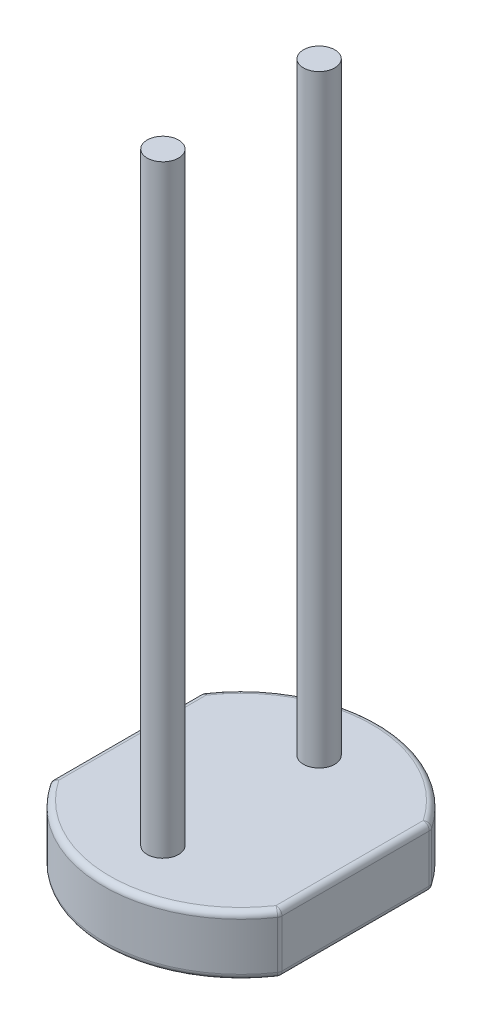
from build123d import *

# Parameters (mm, degrees)
BOSS_EXTRUDE1_DEPTH      = 1
BOSS_EXTRUDE2_DEPTH      = 10
BOSS_EXTRUDE2_DEPTH_BACK = 1.1
SKETCH2_R                = 0.26
CUT_EXTRUDE1_DEPTH       = 0.01
FILLET1_R                = 0.1


with BuildPart() as part:
    # Sketch1 → Boss-Extrude1 (new body)
    with BuildSketch(Plane(origin=(0, 0, 0), x_dir=(1, 0, 0), z_dir=(0, 1, 0))):
        with BuildLine():
            Line((-1.9, 1.251249376), (-1.9, -1.251249376))
            ThreePointArc((-1.9, -1.251249376), (0, -2.275), (1.9, -1.251249376))
            Line((1.9, -1.251249376), (1.9, 1.251249376))
            ThreePointArc((1.9, 1.251249376), (0, 2.275), (-1.9, 1.251249376))
        make_face()
    extrude(amount=BOSS_EXTRUDE1_DEPTH)

    # Sketch2 → Boss-Extrude2 (add, two sides: drawn at the far end of the back side and taken through both)
    with BuildSketch(Plane(origin=(0, 1, 0), x_dir=(1, 0, 0), z_dir=(0, 1, 0)).offset(-BOSS_EXTRUDE2_DEPTH_BACK)):
        with Locations((0, 1.295)):
            Circle(SKETCH2_R)
        with Locations((0, -1.295)):
            Circle(SKETCH2_R)
    extrude(amount=BOSS_EXTRUDE2_DEPTH + BOSS_EXTRUDE2_DEPTH_BACK)

    # Sketch4 → Cut-Extrude1 (cut)
    with BuildSketch(Plane.XZ):
        with BuildLine():
            Line((1.9, -1.251249376), (1.9, 1.251249376))
            ThreePointArc((1.9, 1.251249376), (0, 2.275), (-1.9, 1.251249376))
            Line((-1.9, 1.251249376), (-1.9, -1.251249376))
            ThreePointArc((-1.9, -1.251249376), (0, -2.275), (1.9, -1.251249376))
        make_face()
        with BuildLine():
            Line((-1.4, 1.091157642), (-1.4, -1.091157642))
            ThreePointArc((-1.4, -1.091157642), (0, -1.775), (1.4, -1.091157642))
            Line((1.4, -1.091157642), (1.4, 1.091157642))
            ThreePointArc((1.4, 1.091157642), (1.375341403, 1.122078885), (1.35, 1.152443057))
            Line((1.35, 1.152443057), (1.35, -1))
            ThreePointArc((1.35, -1), (1.2, -1.15), (1.05, -1))
            Line((1.05, -1), (1.05, 0.9))
            ThreePointArc((1.05, 0.9), (0.9, 1.05), (0.75, 0.9))
            Line((0.75, 0.9), (0.75, -0.9))
            ThreePointArc((0.75, -0.9), (0.6, -1.05), (0.45, -0.9))
            Line((0.45, -0.9), (0.45, 0.7))
            ThreePointArc((0.45, 0.7), (0.3, 0.85), (0.15, 0.7))
            Line((0.15, 0.7), (0.15, -0.75))
            ThreePointArc((0.15, -0.75), (0, -0.9), (-0.15, -0.75))
            Line((-0.15, -0.75), (-0.15, 0.7))
            ThreePointArc((-0.15, 0.7), (-0.3, 0.85), (-0.45, 0.7))
            Line((-0.45, 0.7), (-0.45, -0.9))
            ThreePointArc((-0.45, -0.9), (-0.6, -1.05), (-0.75, -0.9))
            Line((-0.75, -0.9), (-0.75, 0.9))
            ThreePointArc((-0.75, 0.9), (-0.9, 1.05), (-1.05, 0.9))
            Line((-1.05, 0.9), (-1.05, -1))
            ThreePointArc((-1.05, -1), (-1.2, -1.15), (-1.35, -1))
            Line((-1.35, -1), (-1.35, 1.152443057))
            ThreePointArc((-1.35, 1.152443057), (-1.375341403, 1.122078885), (-1.4, 1.091157642))
        make_face(mode=Mode.SUBTRACT)
        with BuildLine():
            Line((1.25, 1.152443057), (1.25, -1))
            ThreePointArc((1.25, -1), (1.2, -1.05), (1.15, -1))
            Line((1.15, -1), (1.15, 0.9))
            ThreePointArc((1.15, 0.9), (0.9, 1.15), (0.65, 0.9))
            Line((0.65, 0.9), (0.65, -0.9))
            ThreePointArc((0.65, -0.9), (0.6, -0.95), (0.55, -0.9))
            Line((0.55, -0.9), (0.55, 0.7))
            ThreePointArc((0.55, 0.7), (0.3, 0.95), (0.05, 0.7))
            Line((0.05, 0.7), (0.05, -0.75))
            ThreePointArc((0.05, -0.75), (0.035355339, -0.785355339), (0, -0.8))
            ThreePointArc((0, -0.8), (-0.035355339, -0.785355339), (-0.05, -0.75))
            Line((-0.05, -0.75), (-0.05, 0.7))
            ThreePointArc((-0.05, 0.7), (-0.3, 0.95), (-0.55, 0.7))
            Line((-0.55, 0.7), (-0.55, -0.9))
            ThreePointArc((-0.55, -0.9), (-0.6, -0.95), (-0.65, -0.9))
            Line((-0.65, -0.9), (-0.65, 0.9))
            ThreePointArc((-0.65, 0.9), (-0.9, 1.15), (-1.15, 0.9))
            Line((-1.15, 0.9), (-1.15, -1))
            ThreePointArc((-1.15, -1), (-1.2, -1.05), (-1.25, -1))
            Line((-1.25, -1), (-1.25, 1.152443057))
            Line((-1.25, 1.152443057), (-1.25, 1.260208316))
            ThreePointArc((-1.25, 1.260208316), (0, 1.775), (1.25, 1.260208316))
            Line((1.25, 1.260208316), (1.25, 1.152443057))
        make_face(mode=Mode.SUBTRACT)
    extrude(amount=-CUT_EXTRUDE1_DEPTH, mode=Mode.SUBTRACT)

    # Fillet1
    fillet1_edges = [part.edges().sort_by_distance(p)[0] for p in [
        (0, 1, 2.275),
        (-1.9, 1, 0),
        (-1.9, 0.505, 1.251249376),
        (-1.9, 0.505, -1.251249376),
        (1.9, 0.505, 1.251249376),
        (1.9, 0.505, -1.251249376),
        (-1.9, 0.01, 0),
        (0, 0.01, 2.275),
        (1.9, 0.01, 0),
        (0, 1, -2.275),
        (1.9, 1, 0),
        (0, 0.01, -2.275),
    ]]
    fillet(fillet1_edges, radius=FILLET1_R)


solid = part.part
